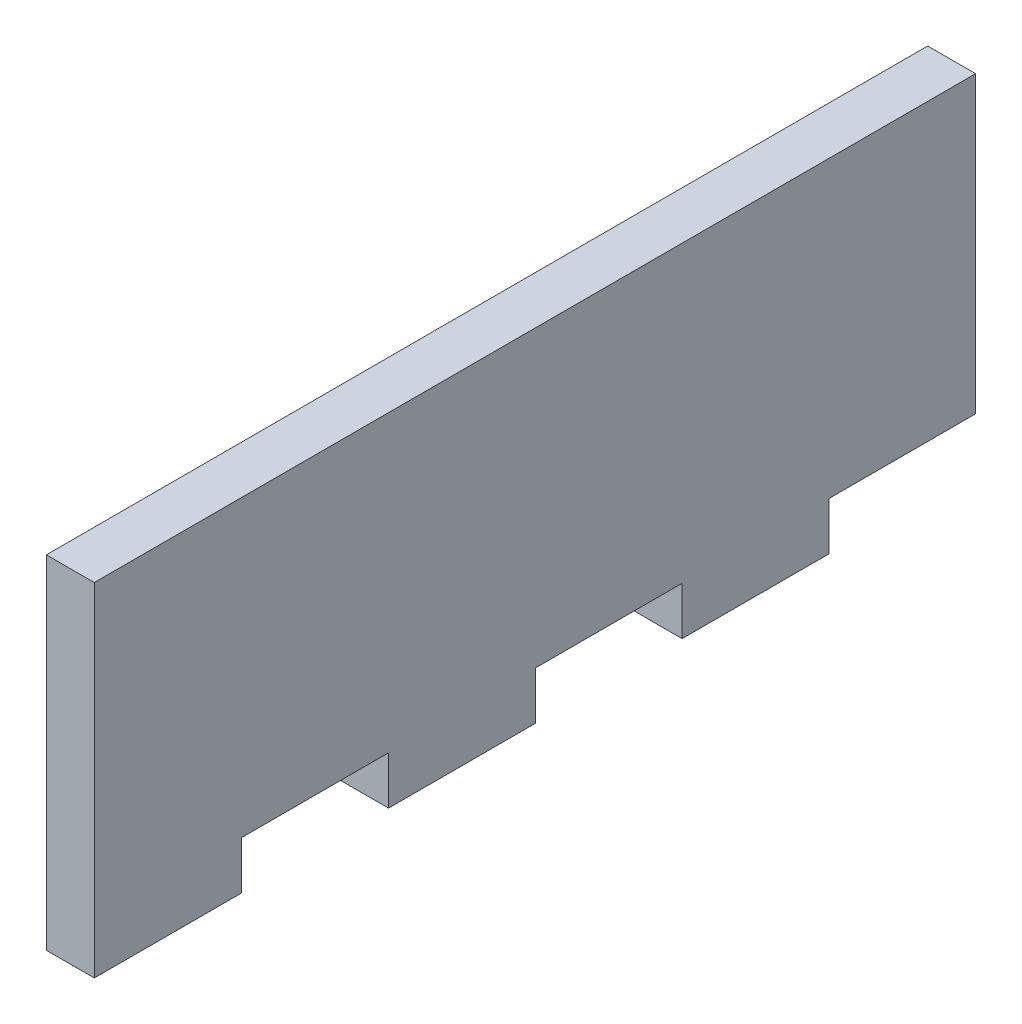
from build123d import *

# Parameters (mm, degrees)
SKETCH2_W           = 114.3
SKETCH2_H           = 38.1
BOSS_EXTRUDE2_DEPTH = 5.334
SKETCH3_W           = 16.256
SKETCH3_H           = 38.1
CUT_EXTRUDE3_DEPTH  = 61.477074632
CAVITY1_START       = -19.05
CAVITY1_OUTLINE_W   = 5.334
CAVITY1_OUTLINE_H   = 16.328571429
CAVITY1_DEPTH       = 5.334


# Read off the part's stored shape, not the designer's step: Cavity1
with BuildPart() as part:
    # Sketch2 → Boss-Extrude2 (new body)
    with BuildSketch(Plane(origin=(0, 0, 0), x_dir=(0, 0, -1), z_dir=(1, 0, 0))):
        Rectangle(SKETCH2_W, SKETCH2_H)
    extrude(amount=BOSS_EXTRUDE2_DEPTH)

    # Sketch3 → Cut-Extrude3 (cut, through all)
    with BuildSketch(Plane(origin=(5.334, 0, 0), x_dir=(0, 0, -1), z_dir=(1, 0, 0))):
        with Locations((49.022, 0)):
            Rectangle(SKETCH3_W, SKETCH3_H)
    extrude(amount=-CUT_EXTRUDE3_DEPTH, mode=Mode.SUBTRACT)

    # Cavity1 outline → Cavity1 (cut)
    with BuildSketch(Plane(origin=(0, 0, 0), x_dir=(1, 0, 0), z_dir=(0, 1, 0)).offset(CAVITY1_START)):
        with Locations((2.667, 32.729714286)):
            Rectangle(CAVITY1_OUTLINE_W, CAVITY1_OUTLINE_H)
        with Locations((2.667, 0.072571428)):
            Rectangle(CAVITY1_OUTLINE_W, CAVITY1_OUTLINE_H)
        with Locations((2.667, -32.584571428)):
            Rectangle(CAVITY1_OUTLINE_W, CAVITY1_OUTLINE_H)
    extrude(amount=CAVITY1_DEPTH, mode=Mode.SUBTRACT)


solid = part.part
